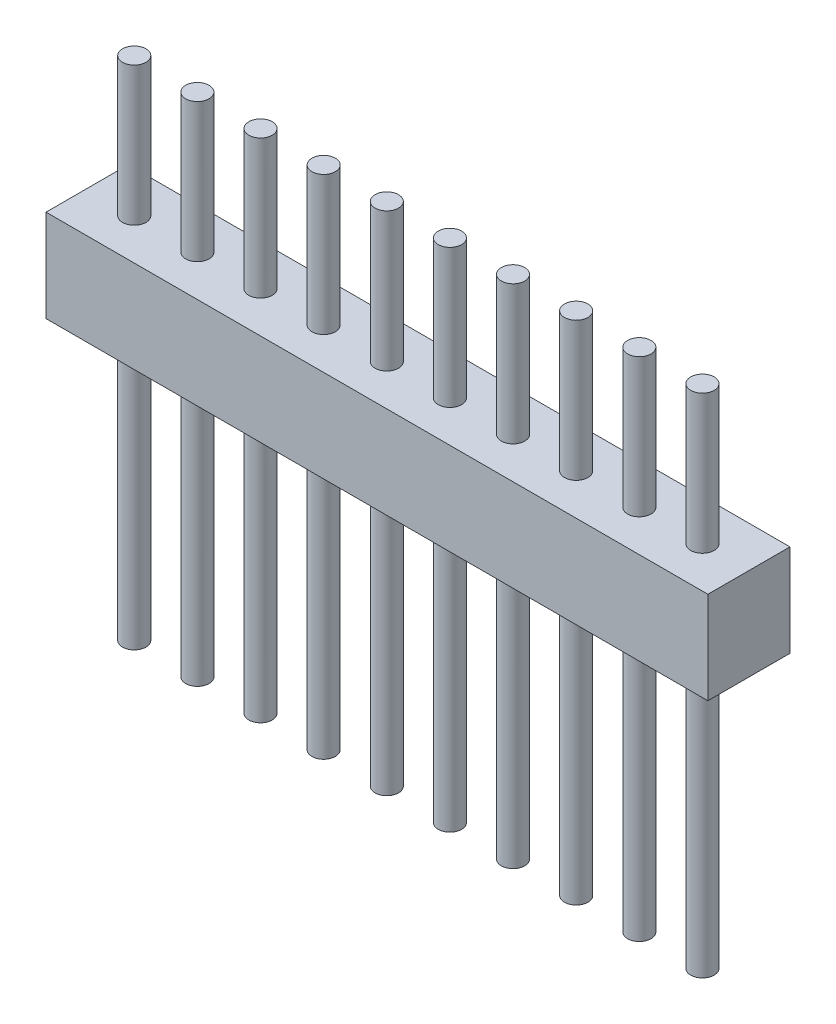
from build123d import *

# Parameters (mm, degrees)
SKETCH1_W                = 18.66
SKETCH1_H                = 2.314
BOSS_EXTRUDE1_DEPTH      = 2.6
BOSS_EXTRUDE2_DEPTH      = 3.91
BOSS_EXTRUDE2_DEPTH_BACK = 10.37
SKETCH2_R                = 0.33


with BuildPart() as part:
    # Sketch1 → Boss-Extrude1 (new body)
    with BuildSketch(Plane(origin=(0, 0, 0), x_dir=(1, 0, 0), z_dir=(0, 1, 0))):
        with Locations((9.33, 1.157)):
            Rectangle(SKETCH1_W, SKETCH1_H)
    extrude(amount=BOSS_EXTRUDE1_DEPTH)

    # Sketch2 → Boss-Extrude2 (add, two sides: drawn at the far end of the back side and taken through both)
    with BuildSketch(Plane(origin=(0, 2.6, 0), x_dir=(1, 0, 0), z_dir=(0, 1, 0)).offset(-BOSS_EXTRUDE2_DEPTH_BACK)):
        with Locations((1.33, 1.157)):
            Circle(SKETCH2_R)
        with Locations((3.11, 1.157)):
            Circle(SKETCH2_R)
        with Locations((4.89, 1.157)):
            Circle(SKETCH2_R)
        with Locations((6.67, 1.157)):
            Circle(SKETCH2_R)
        with Locations((8.45, 1.157)):
            Circle(SKETCH2_R)
        with Locations((10.23, 1.157)):
            Circle(SKETCH2_R)
        with Locations((12.01, 1.157)):
            Circle(SKETCH2_R)
        with Locations((13.79, 1.157)):
            Circle(SKETCH2_R)
        with Locations((15.57, 1.157)):
            Circle(SKETCH2_R)
        with Locations((17.35, 1.157)):
            Circle(SKETCH2_R)
    extrude(amount=BOSS_EXTRUDE2_DEPTH + BOSS_EXTRUDE2_DEPTH_BACK)


solid = part.part
